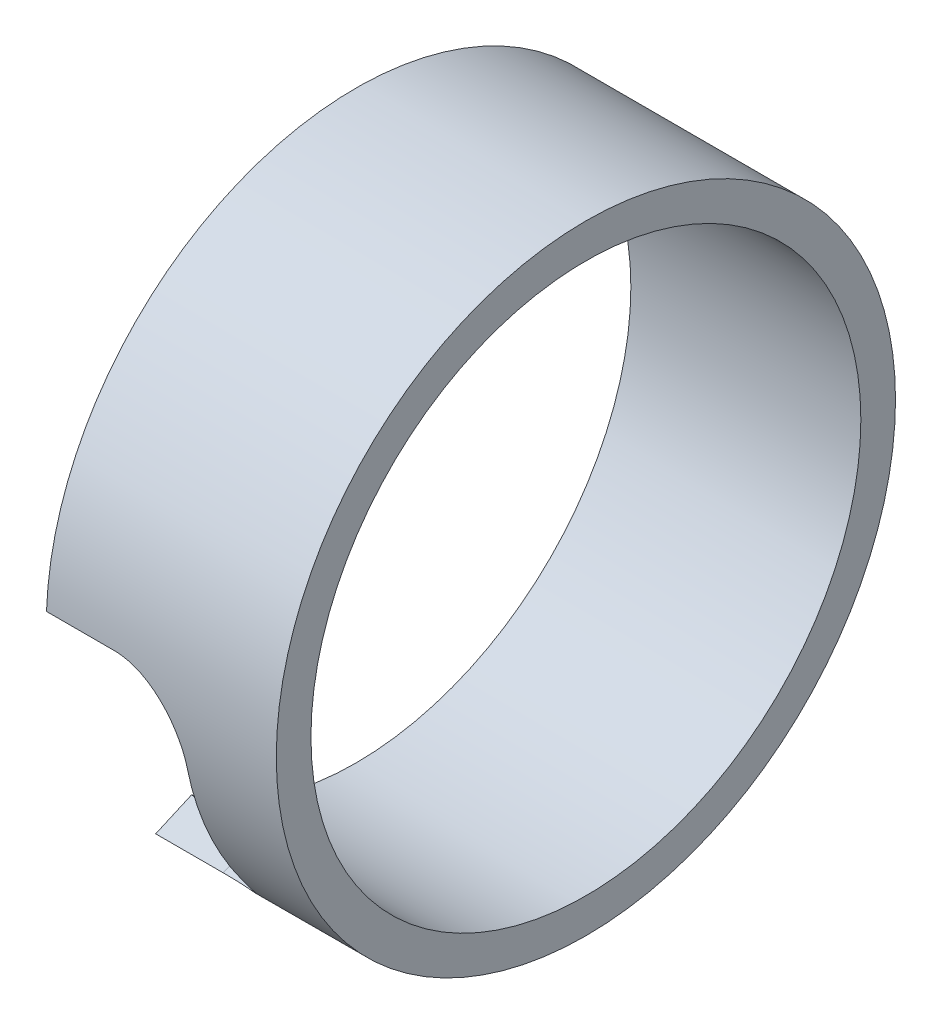
from build123d import *

# Parameters (mm, degrees)
SKETCH1_W          = 6.485999982
SKETCH1_H          = 0.977250014
CUT_EXTRUDE1_REACH = 49.014


with BuildPart() as part:
    # Sketch1 → Revolve1 (revolve)
    with BuildSketch(Plane.XY):
        with Locations((-42.119999961, 8.242624993)):
            Rectangle(SKETCH1_W, SKETCH1_H)
    revolve(axis=Axis((0, 0, 0), (-1, 0, 0)))

    # Sketch3 → Cut-Extrude1 (cut, up to next)
    with BuildSketch(Plane(origin=(0, 0, 0), x_dir=(1, 0, 0), z_dir=(0, -0.40404484571066207, 0.914739177391374)), mode=Mode.PRIVATE) as cut_extrude1_sk1:
        with BuildLine():
            Line((-45.362999952, 3.81), (-45.362999952, -3.81))
            Line((-45.362999952, -3.81), (-43.457999952, -3.81))
            ThreePointArc((-43.457999952, -3.81), (-42.110961534, -3.252038418), (-41.552999952, -1.905))
            Line((-41.552999952, -1.905), (-41.552999952, 1.905))
            ThreePointArc((-41.552999952, 1.905), (-42.110961534, 3.252038418), (-43.457999952, 3.81))
            Line((-43.457999952, 3.81), (-45.362999952, 3.81))
        make_face()
    cut_extrude1_tool1 = extrude(cut_extrude1_sk1.sketch, amount=CUT_EXTRUDE1_REACH, mode=Mode.PRIVATE) & part.part
    add(cut_extrude1_tool1.solids().sort_by_distance((-43.541875, 0, 0))[0], mode=Mode.SUBTRACT)


solid = part.part
